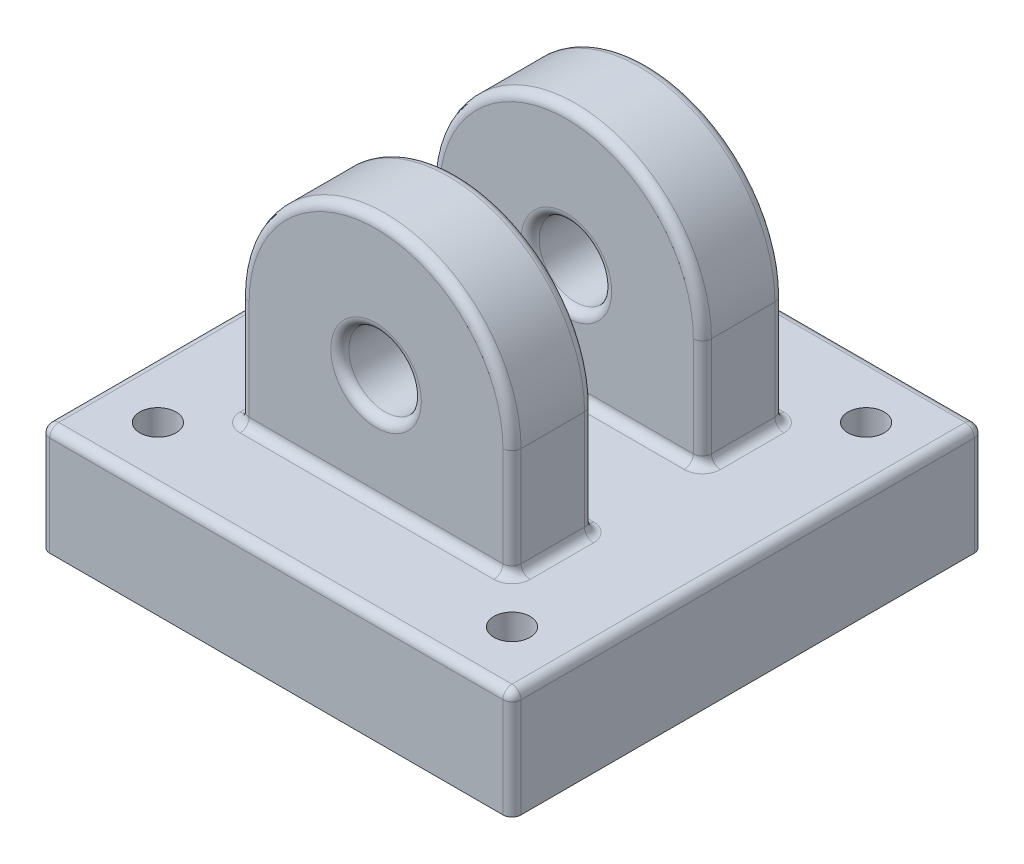
from build123d import *

# Parameters (mm, degrees)
SKETCH1_W                     = 165.1
SKETCH1_H                     = 38.1
BOSS_EXTRUDE1_DEPTH           = 82.55
BOSS_EXTRUDE4_START           = -19.05
SKETCH1_6_R                   = 12.7
BOSS_EXTRUDE4_DEPTH           = 28.575
SKETCH2_R                     = 26
CUT_EXTRUDE1_DEPTH            = 36.83
SKETCH2_3_R                   = 76.2
SKETCH2_3_R_2                 = 69.85
CUT_EXTRUDE2_DEPTH            = 8
BOSS_EXTRUDE6_START           = 47.625
SKETCH1_10_R                  = 12.7
BOSS_EXTRUDE6_DEPTH           = 28.575
F_1_0MM_DOWEL_HOLE4_OUTLINE_R = 6.35
F_1_0MM_DOWEL_HOLE4_DEPTH     = 20.05
F_1_0MM_DOWEL_HOLE5_D         = 12.7
FILLET1_R                     = 3.175
FILLET2_R                     = 3.175


# Read off the part's stored shape, not the designer's step: M14x2.0 Tapped Hole2, Ø1.0mm Dowel Hole4
with BuildPart() as part:
    # Sketch1 → Boss-Extrude1 (new, symmetric)
    with BuildSketch(Plane.XY):
        with Locations((0, 19.05)):
            Rectangle(SKETCH1_W, SKETCH1_H)
    extrude(amount=BOSS_EXTRUDE1_DEPTH, both=True)

    # Sketch1<6> → Boss-Extrude4 (add)
    with BuildSketch(Plane.XY.offset(BOSS_EXTRUDE4_START)):
        with BuildLine():
            Line((-47.625, 76.2), (-47.625, 38.1))
            Line((-47.625, 38.1), (47.625, 38.1))
            Line((47.625, 38.1), (47.625, 76.2))
            ThreePointArc((47.625, 76.2), (0, 123.825), (-47.625, 76.2))
        make_face()
        with Locations((0, 76.2)):
            Circle(SKETCH1_6_R, mode=Mode.SUBTRACT)
    extrude(amount=-BOSS_EXTRUDE4_DEPTH)

    # Sketch2 → Cut-Extrude1 (cut)
    with BuildSketch(Plane.XZ):
        with Locations(Location((0, 0, 0), (0, 0, 270))):
            Circle(SKETCH2_R)
    extrude(amount=-CUT_EXTRUDE1_DEPTH, mode=Mode.SUBTRACT)

    # Sketch2<3> → Cut-Extrude2 (cut)
    with BuildSketch(Plane.XZ):
        with Locations(Location((0, 0, 0), (0, 0, 270))):
            Circle(SKETCH2_3_R)
        with Locations(Location((0, 0, 0), (0, 0, 270))):
            Circle(SKETCH2_3_R_2, mode=Mode.SUBTRACT)
    extrude(amount=-CUT_EXTRUDE2_DEPTH, mode=Mode.SUBTRACT)

    # Sketch1<10> → Boss-Extrude6 (add)
    with BuildSketch(Plane.XY.offset(BOSS_EXTRUDE6_START)):
        with BuildLine():
            Line((-47.625, 76.2), (-47.625, 38.1))
            Line((-47.625, 38.1), (47.625, 38.1))
            Line((47.625, 38.1), (47.625, 76.2))
            ThreePointArc((47.625, 76.2), (0, 123.825), (-47.625, 76.2))
        make_face()
        with Locations((0, 76.2)):
            Circle(SKETCH1_10_R, mode=Mode.SUBTRACT)
    extrude(amount=-BOSS_EXTRUDE6_DEPTH)

    # M14x2.0 Tapped Hole2 outline → M14x2.0 Tapped Hole2 (revolve, cut)
    with BuildSketch(Plane(origin=(0, 20.05, 0), x_dir=(0, 1, 0), z_dir=(0, 0, -1))):
        Polygon((6, -81.560169006), (6, -25.298065783), (0, -25.298065783), (0, -82.55), (7.025, -82.55), align=None)
    revolve(axis=Axis((0, 20.05, 0), (1, 0, 0)), mode=Mode.SUBTRACT)

    # Ø1.0mm Dowel Hole4 outline → Ø1.0mm Dowel Hole4 (cut)
    with BuildSketch(Plane(origin=(0, 0, 0), x_dir=(1, 0, 0), z_dir=(0, 1, 0))):
        with Locations((-50.55, 0)):
            Circle(F_1_0MM_DOWEL_HOLE4_OUTLINE_R)
    extrude(amount=F_1_0MM_DOWEL_HOLE4_DEPTH, mode=Mode.SUBTRACT)

    # Ø1.0mm Dowel Hole5 (through all)
    with Locations(Plane(origin=(0, 38.1, 0), x_dir=(1, 0, 0), z_dir=(0, 1, 0))):
        with Locations((-62.017554956, 62.017554956), (62.017554956, -62.017554956), (62.017554956, 62.017554956), (-62.017554956, -62.017554956)):
            Hole(F_1_0MM_DOWEL_HOLE5_D / 2)

    # Fillet1
    fillet1_edges = [part.edges().sort_by_distance(p)[0] for p in [
        (82.55, 19.05, 82.55),
        (-82.55, 19.05, 82.55),
        (-82.55, 19.05, -82.55),
        (82.55, 19.05, -82.55),
    ]]
    fillet(fillet1_edges, radius=FILLET1_R)

    # Fillet2
    fillet2_edges = [part.edges().sort_by_distance(p)[0] for p in [
        (0, 38.1, -82.55),
        (-82.55, 38.1, 0),
        (0, 38.1, 82.55),
        (82.55, 38.1, 0),
        (81.62006403, 38.1, 81.62006403),
        (81.62006403, 38.1, -81.62006403),
        (-81.62006403, 38.1, 81.62006403),
        (-81.62006403, 38.1, -81.62006403),
        (0, 123.825, -19.05),
        (47.625, 57.15, -19.05),
        (0, 38.1, -47.625),
        (47.625, 38.1, -33.3375),
        (-12.7, 76.2, -19.05),
        (-47.625, 57.15, -19.05),
        (-47.625, 38.1, -33.3375),
        (-12.7, 76.2, -47.625),
        (0, 123.825, -47.625),
        (47.625, 57.15, -47.625),
        (-47.625, 57.15, -47.625),
        (0, 38.1, -19.05),
        (0, 123.825, 47.625),
        (-47.625, 57.15, 47.625),
        (0, 38.1, 19.05),
        (-47.625, 38.1, 33.3375),
        (-12.7, 76.2, 47.625),
        (47.625, 57.15, 47.625),
        (47.625, 38.1, 33.3375),
        (0, 38.1, 47.625),
        (-12.7, 76.2, 19.05),
        (0, 123.825, 19.05),
        (47.625, 57.15, 19.05),
        (-47.625, 57.15, 19.05),
    ]]
    fillet(fillet2_edges, radius=FILLET2_R)


solid = part.part
